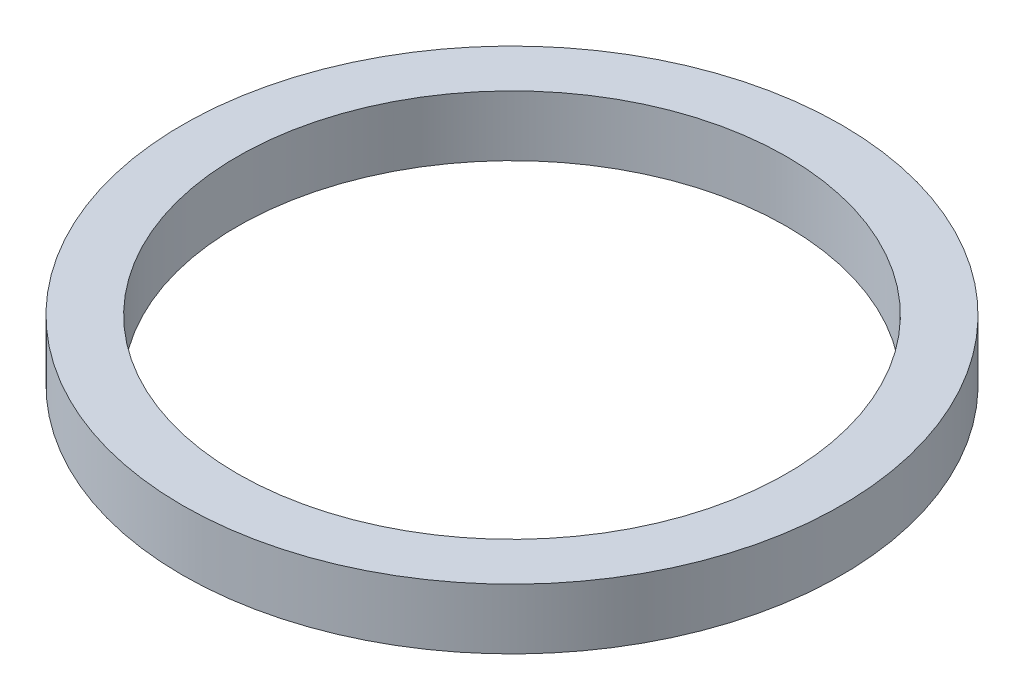
from build123d import *

# Parameters (mm, degrees)
SKETCH1_R           = 60
BOSS_EXTRUDE1_DEPTH = 11
SKETCH2_R           = 50
CUT_EXTRUDE1_DEPTH  = 86.562842403


with BuildPart() as part:
    # Sketch1 → Boss-Extrude1 (new body)
    with BuildSketch(Plane(origin=(0, 0, 0), x_dir=(1, 0, 0), z_dir=(0, 1, 0))):
        Circle(SKETCH1_R)
    extrude(amount=BOSS_EXTRUDE1_DEPTH)

    # Sketch2 → Cut-Extrude1 (cut, through all)
    with BuildSketch(Plane(origin=(0, 0, 0), x_dir=(1, 0, 0), z_dir=(0, 1, 0))):
        Circle(SKETCH2_R)
    extrude(amount=CUT_EXTRUDE1_DEPTH, mode=Mode.SUBTRACT)


solid = part.part
